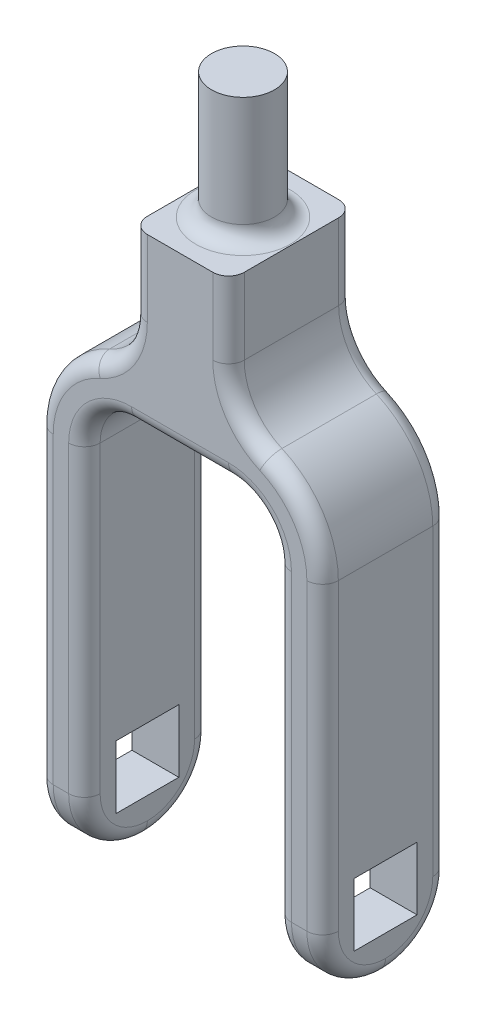
from build123d import *

# Parameters (mm, degrees)
BOSS_EXTRUDE1_DEPTH = 12.7
SKETCH2_W           = 9.779
SKETCH2_H           = 12.7
BOSS_EXTRUDE2_DEPTH = 12.7
FILLET1_R           = 6.35
SKETCH3_R           = 3.175
BOSS_EXTRUDE3_DEPTH = 12.7
SKETCH4_W           = 6.35
SKETCH4_H           = 6.35
CUT_EXTRUDE1_DEPTH  = 43.688
FILLET2_R           = 6.35
FILLET5_R           = 1.5875
FILLET7_R           = 1.5875


with BuildPart() as part:
    # Sketch1 → Boss-Extrude1 (new body)
    with BuildSketch(Plane.XY):
        with BuildLine():
            Line((9.652, 30), (9.652, -6.985))
            Line((9.652, -6.985), (14.38275, -6.985))
            Line((14.38275, -6.985), (14.38275, 30))
            ThreePointArc((14.38275, 30), (11.60224145, 36.71274145), (4.8895, 39.49325))
            Line((4.8895, 39.49325), (-4.8895, 39.49325))
            ThreePointArc((-4.8895, 39.49325), (-11.60224145, 36.71274145), (-14.38275, 30))
            Line((-14.38275, 30), (-14.38275, -6.985))
            Line((-14.38275, -6.985), (-9.652, -6.985))
            Line((-9.652, -6.985), (-9.652, 30))
            ThreePointArc((-9.652, 30), (-8.257096045, 33.367596045), (-4.8895, 34.7625))
            Line((-4.8895, 34.7625), (4.8895, 34.7625))
            ThreePointArc((4.8895, 34.7625), (8.257096045, 33.367596045), (9.652, 30))
        make_face()
    extrude(amount=BOSS_EXTRUDE1_DEPTH)

    # Sketch2 → Boss-Extrude2 (add)
    with BuildSketch(Plane(origin=(0, 39.49325, 0), x_dir=(1, 0, 0), z_dir=(0, 1, 0))):
        with Locations((0, -6.35)):
            Rectangle(SKETCH2_W, SKETCH2_H)
    extrude(amount=BOSS_EXTRUDE2_DEPTH)

    # Fillet1
    fillet1_edges = [part.edges().sort_by_distance(p)[0] for p in [
        (4.8895, 39.49325, 6.35),
        (-4.8895, 39.49325, 6.35),
    ]]
    fillet(fillet1_edges, radius=FILLET1_R)

    # Sketch3 → Boss-Extrude3 (add)
    with BuildSketch(Plane(origin=(0, 52.19325, 0), x_dir=(1, 0, 0), z_dir=(0, 1, 0))):
        with Locations(Location((0, -6.35, 0), (0, 0, 180))):
            Circle(SKETCH3_R)
    extrude(amount=BOSS_EXTRUDE3_DEPTH)

    # Sketch4 → Cut-Extrude1 (cut)
    with BuildSketch(Plane.ZY.offset(14.38275)):
        with Locations((6.35, 0)):
            Rectangle(SKETCH4_W, SKETCH4_H)
    extrude(amount=-CUT_EXTRUDE1_DEPTH, mode=Mode.SUBTRACT)

    # Fillet2
    fillet2_edges = [part.edges().sort_by_distance(p)[0] for p in [
        (12.017375, -6.985, 0),
        (12.017375, -6.985, 12.7),
        (-12.017375, -6.985, 0),
        (-12.017375, -6.985, 12.7),
    ]]
    fillet(fillet2_edges, radius=FILLET2_R - 0.0001)  # a hair under: the kernel refuses the full size

    # Fillet5
    fillet5_edges = [part.edges().sort_by_distance(p)[0] for p in [
        (-14.38275, 14.68245, 12.7),
        (-9.652, 14.68245, 12.7),
        (9.652, 14.68245, 12.7),
        (14.38275, 14.68245, 12.7),
        (14.38275, 14.68245, 0),
        (14.38275, -5.12515735, 1.85984265),
        (14.38275, -5.12515735, 10.84015735),
        (9.652, 14.68245, 0),
        (9.652, -5.12515735, 1.85984265),
        (9.652, -5.12515735, 10.84015735),
        (-9.652, 14.68245, 0),
        (-14.38275, 14.68245, 0),
        (-9.652, -5.12515735, 1.85984265),
        (-9.652, -5.12515735, 10.84015735),
        (-14.38275, -5.12515735, 1.85984265),
        (-14.38275, -5.12515735, 10.84015735),
        (12.83439634, 35.196192617, 0),
        (8.257096045, 33.367596045, 0),
        (0, 34.7625, 0),
        (-8.257096045, 33.367596045, 0),
        (-8.257096045, 33.367596045, 12.7),
        (0, 34.7625, 12.7),
        (-4.8895, 48.354139564, 0),
        (-4.8895, 48.354139564, 12.7),
        (4.8895, 48.354139564, 12.7),
        (4.8895, 48.354139564, 0),
        (8.257096045, 33.367596045, 12.7),
        (-12.83439634, 35.196192617, 0),
        (-12.83439634, 35.196192617, 12.7),
        (-5.925188067, 41.039315002, 0),
        (-5.925188067, 41.039315002, 12.7),
        (5.925188067, 41.039315002, 0),
        (5.925188067, 41.039315002, 12.7),
        (12.83439634, 35.196192617, 12.7),
    ]]
    fillet(fillet5_edges, radius=FILLET5_R)

    # Fillet7
    fillet7_edges = [part.edges().sort_by_distance(p)[0] for p in [
        (3.175, 52.19325, 6.35),
    ]]
    fillet(fillet7_edges, radius=FILLET7_R)


solid = part.part
